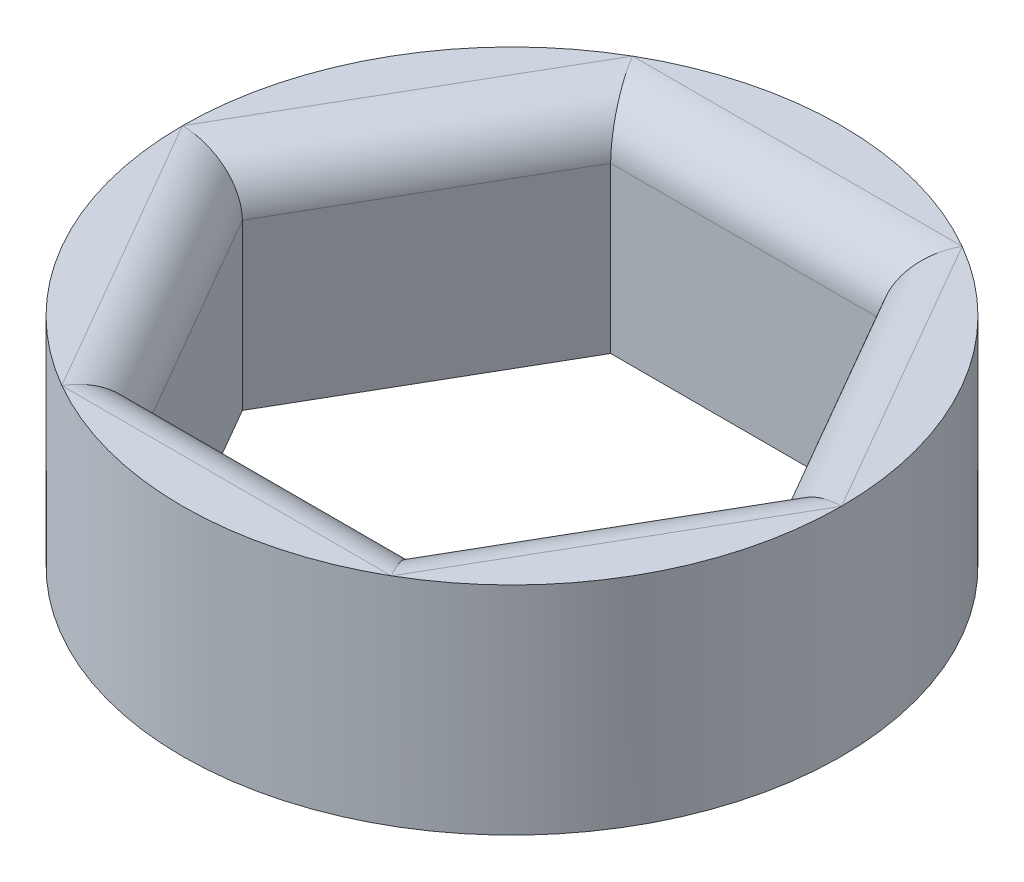
from build123d import *

# Parameters (mm, degrees)
SKETCH1_R           = 6.35
BOSS_EXTRUDE1_DEPTH = 4.175
FILLET1_R           = 1


with BuildPart() as part:
    # Sketch1 → Boss-Extrude1 (new body)
    with BuildSketch(Plane(origin=(0, 0, 0), x_dir=(1, 0, 0), z_dir=(0, 1, 0))):
        with Locations(Location((0, 0, 0), (0, 0, 270))):
            Circle(SKETCH1_R)
        Polygon((5.196152423, 0), (2.598076211, 4.5), (-2.598076211, 4.5), (-5.196152423, 0), (-2.598076211, -4.5), (2.598076211, -4.5), align=None, mode=Mode.SUBTRACT)
    extrude(amount=BOSS_EXTRUDE1_DEPTH)

    # Fillet1
    # the kernel refuses this fillet: 1 mm, written as the material it takes off along each edge
    with BuildSketch(Plane(origin=(1.348076211, 4.175, 6.665063509), x_dir=(0, -1, 0), z_dir=(0.4999999999999997, 0, -0.8660254037844388))) as fillet1_piece_1_section:
        with BuildLine():
            CenterArc((FILLET1_R, -FILLET1_R), FILLET1_R, 90, 90)
            Line((0, -FILLET1_R), (-FILLET1_R * 0.02, -FILLET1_R))
            Line((-FILLET1_R * 0.02, -FILLET1_R), (-FILLET1_R * 0.02, FILLET1_R * 0.02))
            Line((-FILLET1_R * 0.02, FILLET1_R * 0.02), (FILLET1_R, FILLET1_R * 0.02))
            Line((FILLET1_R, FILLET1_R * 0.02), (FILLET1_R, 0))
        make_face()
    fillet1_piece_1 = extrude(amount=10.196152423, mode=Mode.PRIVATE)
    fillet1_piece_1 = split(fillet1_piece_1, bisect_by=Plane(origin=(4.083759971, 3.942180167, 4.5), z_dir=(0, 0, -1)), keep=Keep.TOP, mode=Mode.PRIVATE)
    fillet1_piece_1 = split(fillet1_piece_1, bisect_by=Plane(origin=(5.938994303, 3.942180167, 1.286639878), z_dir=(-0.8660254037844387, 0, 0.49999999999999983)), keep=Keep.TOP, mode=Mode.PRIVATE)
    add(fillet1_piece_1, mode=Mode.SUBTRACT)
    with BuildSketch(Plane(origin=(6.446152423, 4.175, 2.165063509), x_dir=(0, -1, 0), z_dir=(-0.4999999999999999, 0, -0.8660254037844388))) as fillet1_piece_2_section:
        with BuildLine():
            CenterArc((FILLET1_R, -FILLET1_R), FILLET1_R, 90, 90)
            Line((0, -FILLET1_R), (-FILLET1_R * 0.02, -FILLET1_R))
            Line((-FILLET1_R * 0.02, -FILLET1_R), (-FILLET1_R * 0.02, FILLET1_R * 0.02))
            Line((-FILLET1_R * 0.02, FILLET1_R * 0.02), (FILLET1_R, FILLET1_R * 0.02))
            Line((FILLET1_R, FILLET1_R * 0.02), (FILLET1_R, 0))
        make_face()
    fillet1_piece_2 = extrude(amount=10.196152423, mode=Mode.PRIVATE)
    fillet1_piece_2 = split(fillet1_piece_2, bisect_by=Plane(origin=(5.938994303, 3.942180167, -1.286639878), z_dir=(-0.8660254037844388, 0, -0.4999999999999997)), keep=Keep.TOP, mode=Mode.PRIVATE)
    fillet1_piece_2 = split(fillet1_piece_2, bisect_by=Plane(origin=(4.083759971, 3.942180167, -4.5), z_dir=(0, 0, 1)), keep=Keep.TOP, mode=Mode.PRIVATE)
    add(fillet1_piece_2, mode=Mode.SUBTRACT)
    with BuildSketch(Plane(origin=(5.098076211, 4.175, -4.5), x_dir=(0, -1, 0), z_dir=(-1, 0, 0))) as fillet1_piece_3_section:
        with BuildLine():
            CenterArc((FILLET1_R, -FILLET1_R), FILLET1_R, 90, 90)
            Line((0, -FILLET1_R), (-FILLET1_R * 0.02, -FILLET1_R))
            Line((-FILLET1_R * 0.02, -FILLET1_R), (-FILLET1_R * 0.02, FILLET1_R * 0.02))
            Line((-FILLET1_R * 0.02, FILLET1_R * 0.02), (FILLET1_R, FILLET1_R * 0.02))
            Line((FILLET1_R, FILLET1_R * 0.02), (FILLET1_R, 0))
        make_face()
    fillet1_piece_3 = extrude(amount=10.196152423, mode=Mode.PRIVATE)
    fillet1_piece_3 = split(fillet1_piece_3, bisect_by=Plane(origin=(-1.855234331, 3.942180167, -5.786639878), z_dir=(0.8660254037844387, 0, 0.4999999999999999)), keep=Keep.TOP, mode=Mode.PRIVATE)
    fillet1_piece_3 = split(fillet1_piece_3, bisect_by=Plane(origin=(1.855234331, 3.942180167, -5.786639878), z_dir=(-0.8660254037844387, 0, 0.49999999999999983)), keep=Keep.TOP, mode=Mode.PRIVATE)
    add(fillet1_piece_3, mode=Mode.SUBTRACT)
    with BuildSketch(Plane(origin=(-1.348076211, 4.175, -6.665063509), x_dir=(0, -1, 0), z_dir=(-0.4999999999999999, 0, 0.8660254037844387))) as fillet1_piece_4_section:
        with BuildLine():
            CenterArc((FILLET1_R, -FILLET1_R), FILLET1_R, 90, 90)
            Line((0, -FILLET1_R), (-FILLET1_R * 0.02, -FILLET1_R))
            Line((-FILLET1_R * 0.02, -FILLET1_R), (-FILLET1_R * 0.02, FILLET1_R * 0.02))
            Line((-FILLET1_R * 0.02, FILLET1_R * 0.02), (FILLET1_R, FILLET1_R * 0.02))
            Line((FILLET1_R, FILLET1_R * 0.02), (FILLET1_R, 0))
        make_face()
    fillet1_piece_4 = extrude(amount=10.196152423, mode=Mode.PRIVATE)
    fillet1_piece_4 = split(fillet1_piece_4, bisect_by=Plane(origin=(-5.938994303, 3.942180167, -1.286639878), z_dir=(0.8660254037844388, 0, -0.4999999999999998)), keep=Keep.TOP, mode=Mode.PRIVATE)
    fillet1_piece_4 = split(fillet1_piece_4, bisect_by=Plane(origin=(-4.083759971, 3.942180167, -4.5), z_dir=(0, 0, 1)), keep=Keep.TOP, mode=Mode.PRIVATE)
    add(fillet1_piece_4, mode=Mode.SUBTRACT)
    with BuildSketch(Plane(origin=(-6.446152423, 4.175, -2.165063509), x_dir=(0, -1, 0), z_dir=(0.4999999999999998, 0, 0.8660254037844388))) as fillet1_piece_5_section:
        with BuildLine():
            CenterArc((FILLET1_R, -FILLET1_R), FILLET1_R, 90, 90)
            Line((0, -FILLET1_R), (-FILLET1_R * 0.02, -FILLET1_R))
            Line((-FILLET1_R * 0.02, -FILLET1_R), (-FILLET1_R * 0.02, FILLET1_R * 0.02))
            Line((-FILLET1_R * 0.02, FILLET1_R * 0.02), (FILLET1_R, FILLET1_R * 0.02))
            Line((FILLET1_R, FILLET1_R * 0.02), (FILLET1_R, 0))
        make_face()
    fillet1_piece_5 = extrude(amount=10.196152423, mode=Mode.PRIVATE)
    fillet1_piece_5 = split(fillet1_piece_5, bisect_by=Plane(origin=(-4.083759971, 3.942180167, 4.5), z_dir=(0, 0, -1)), keep=Keep.TOP, mode=Mode.PRIVATE)
    fillet1_piece_5 = split(fillet1_piece_5, bisect_by=Plane(origin=(-5.938994303, 3.942180167, 1.286639878), z_dir=(0.8660254037844387, 0, 0.4999999999999999)), keep=Keep.TOP, mode=Mode.PRIVATE)
    add(fillet1_piece_5, mode=Mode.SUBTRACT)
    with BuildSketch(Plane(origin=(-5.098076211, 4.175, 4.5), x_dir=(0, -1, 0), z_dir=(1, 0, 0))) as fillet1_piece_6_section:
        with BuildLine():
            CenterArc((FILLET1_R, -FILLET1_R), FILLET1_R, 90, 90)
            Line((0, -FILLET1_R), (-FILLET1_R * 0.02, -FILLET1_R))
            Line((-FILLET1_R * 0.02, -FILLET1_R), (-FILLET1_R * 0.02, FILLET1_R * 0.02))
            Line((-FILLET1_R * 0.02, FILLET1_R * 0.02), (FILLET1_R, FILLET1_R * 0.02))
            Line((FILLET1_R, FILLET1_R * 0.02), (FILLET1_R, 0))
        make_face()
    fillet1_piece_6 = extrude(amount=10.196152423, mode=Mode.PRIVATE)
    fillet1_piece_6 = split(fillet1_piece_6, bisect_by=Plane(origin=(1.855234331, 3.942180167, 5.786639878), z_dir=(-0.8660254037844388, 0, -0.4999999999999997)), keep=Keep.TOP, mode=Mode.PRIVATE)
    fillet1_piece_6 = split(fillet1_piece_6, bisect_by=Plane(origin=(-1.855234331, 3.942180167, 5.786639878), z_dir=(0.8660254037844388, 0, -0.4999999999999998)), keep=Keep.TOP, mode=Mode.PRIVATE)
    add(fillet1_piece_6, mode=Mode.SUBTRACT)
    with BuildSketch(Plane(origin=(1.348076211, 4.175, 6.665063509), x_dir=(0, -1, 0), z_dir=(0.4999999999999997, 0, -0.8660254037844388))) as fillet1_piece_7a_section:
        with BuildLine():
            CenterArc((FILLET1_R, -FILLET1_R), FILLET1_R, 90, 90)
            Line((0, -FILLET1_R), (-FILLET1_R * 0.02, -FILLET1_R))
            Line((-FILLET1_R * 0.02, -FILLET1_R), (-FILLET1_R * 0.02, FILLET1_R * 0.02))
            Line((-FILLET1_R * 0.02, FILLET1_R * 0.02), (FILLET1_R, FILLET1_R * 0.02))
            Line((FILLET1_R, FILLET1_R * 0.02), (FILLET1_R, 0))
        make_face()
    fillet1_piece_7a = extrude(amount=10.196152423, mode=Mode.PRIVATE)
    fillet1_piece_7a = split(fillet1_piece_7a, bisect_by=Plane(origin=(2.212123178, 3.95463069, 4.5), z_dir=(0, 0, 1)), keep=Keep.TOP, mode=Mode.PRIVATE)
    with BuildSketch(Plane(origin=(-5.098076211, 4.175, 4.5), x_dir=(0, -1, 0), z_dir=(1, 0, 0))) as fillet1_piece_7b_section:
        with BuildLine():
            CenterArc((FILLET1_R, -FILLET1_R), FILLET1_R, 90, 90)
            Line((0, -FILLET1_R), (-FILLET1_R * 0.02, -FILLET1_R))
            Line((-FILLET1_R * 0.02, -FILLET1_R), (-FILLET1_R * 0.02, FILLET1_R * 0.02))
            Line((-FILLET1_R * 0.02, FILLET1_R * 0.02), (FILLET1_R, FILLET1_R * 0.02))
            Line((FILLET1_R, FILLET1_R * 0.02), (FILLET1_R, 0))
        make_face()
    fillet1_piece_7b = extrude(amount=10.196152423, mode=Mode.PRIVATE)
    fillet1_piece_7b = split(fillet1_piece_7b, bisect_by=Plane(origin=(2.791052728, 3.95463069, 4.165754869), z_dir=(0.8660254037844388, 0, 0.4999999999999997)), keep=Keep.TOP, mode=Mode.PRIVATE)
    fillet1_piece_7 = fillet1_piece_7a & fillet1_piece_7b
    add(fillet1_piece_7, mode=Mode.SUBTRACT)
    with BuildSketch(Plane(origin=(1.348076211, 4.175, 6.665063509), x_dir=(0, -1, 0), z_dir=(0.4999999999999997, 0, -0.8660254037844388))) as fillet1_piece_8a_section:
        with BuildLine():
            CenterArc((FILLET1_R, -FILLET1_R), FILLET1_R, 90, 90)
            Line((0, -FILLET1_R), (-FILLET1_R * 0.02, -FILLET1_R))
            Line((-FILLET1_R * 0.02, -FILLET1_R), (-FILLET1_R * 0.02, FILLET1_R * 0.02))
            Line((-FILLET1_R * 0.02, FILLET1_R * 0.02), (FILLET1_R, FILLET1_R * 0.02))
            Line((FILLET1_R, FILLET1_R * 0.02), (FILLET1_R, 0))
        make_face()
    fillet1_piece_8a = extrude(amount=10.196152423, mode=Mode.PRIVATE)
    fillet1_piece_8a = split(fillet1_piece_8a, bisect_by=Plane(origin=(5.003175906, 3.95463069, -0.334245131), z_dir=(0.8660254037844387, 0, -0.49999999999999983)), keep=Keep.TOP, mode=Mode.PRIVATE)
    with BuildSketch(Plane(origin=(6.446152423, 4.175, 2.165063509), x_dir=(0, -1, 0), z_dir=(-0.4999999999999999, 0, -0.8660254037844388))) as fillet1_piece_8b_section:
        with BuildLine():
            CenterArc((FILLET1_R, -FILLET1_R), FILLET1_R, 90, 90)
            Line((0, -FILLET1_R), (-FILLET1_R * 0.02, -FILLET1_R))
            Line((-FILLET1_R * 0.02, -FILLET1_R), (-FILLET1_R * 0.02, FILLET1_R * 0.02))
            Line((-FILLET1_R * 0.02, FILLET1_R * 0.02), (FILLET1_R, FILLET1_R * 0.02))
            Line((FILLET1_R, FILLET1_R * 0.02), (FILLET1_R, 0))
        make_face()
    fillet1_piece_8b = extrude(amount=10.196152423, mode=Mode.PRIVATE)
    fillet1_piece_8b = split(fillet1_piece_8b, bisect_by=Plane(origin=(5.003175906, 3.95463069, 0.334245131), z_dir=(0.8660254037844388, 0, 0.4999999999999997)), keep=Keep.TOP, mode=Mode.PRIVATE)
    fillet1_piece_8 = fillet1_piece_8a & fillet1_piece_8b
    add(fillet1_piece_8, mode=Mode.SUBTRACT)
    with BuildSketch(Plane(origin=(5.098076211, 4.175, -4.5), x_dir=(0, -1, 0), z_dir=(-1, 0, 0))) as fillet1_piece_9a_section:
        with BuildLine():
            CenterArc((FILLET1_R, -FILLET1_R), FILLET1_R, 90, 90)
            Line((0, -FILLET1_R), (-FILLET1_R * 0.02, -FILLET1_R))
            Line((-FILLET1_R * 0.02, -FILLET1_R), (-FILLET1_R * 0.02, FILLET1_R * 0.02))
            Line((-FILLET1_R * 0.02, FILLET1_R * 0.02), (FILLET1_R, FILLET1_R * 0.02))
            Line((FILLET1_R, FILLET1_R * 0.02), (FILLET1_R, 0))
        make_face()
    fillet1_piece_9a = extrude(amount=10.196152423, mode=Mode.PRIVATE)
    fillet1_piece_9a = split(fillet1_piece_9a, bisect_by=Plane(origin=(2.791052728, 3.95463069, -4.165754869), z_dir=(0.8660254037844387, 0, -0.49999999999999983)), keep=Keep.TOP, mode=Mode.PRIVATE)
    with BuildSketch(Plane(origin=(6.446152423, 4.175, 2.165063509), x_dir=(0, -1, 0), z_dir=(-0.4999999999999999, 0, -0.8660254037844388))) as fillet1_piece_9b_section:
        with BuildLine():
            CenterArc((FILLET1_R, -FILLET1_R), FILLET1_R, 90, 90)
            Line((0, -FILLET1_R), (-FILLET1_R * 0.02, -FILLET1_R))
            Line((-FILLET1_R * 0.02, -FILLET1_R), (-FILLET1_R * 0.02, FILLET1_R * 0.02))
            Line((-FILLET1_R * 0.02, FILLET1_R * 0.02), (FILLET1_R, FILLET1_R * 0.02))
            Line((FILLET1_R, FILLET1_R * 0.02), (FILLET1_R, 0))
        make_face()
    fillet1_piece_9b = extrude(amount=10.196152423, mode=Mode.PRIVATE)
    fillet1_piece_9b = split(fillet1_piece_9b, bisect_by=Plane(origin=(2.212123178, 3.95463069, -4.5), z_dir=(0, 0, -1)), keep=Keep.TOP, mode=Mode.PRIVATE)
    fillet1_piece_9 = fillet1_piece_9a & fillet1_piece_9b
    add(fillet1_piece_9, mode=Mode.SUBTRACT)
    with BuildSketch(Plane(origin=(-1.348076211, 4.175, -6.665063509), x_dir=(0, -1, 0), z_dir=(-0.4999999999999999, 0, 0.8660254037844387))) as fillet1_piece_10a_section:
        with BuildLine():
            CenterArc((FILLET1_R, -FILLET1_R), FILLET1_R, 90, 90)
            Line((0, -FILLET1_R), (-FILLET1_R * 0.02, -FILLET1_R))
            Line((-FILLET1_R * 0.02, -FILLET1_R), (-FILLET1_R * 0.02, FILLET1_R * 0.02))
            Line((-FILLET1_R * 0.02, FILLET1_R * 0.02), (FILLET1_R, FILLET1_R * 0.02))
            Line((FILLET1_R, FILLET1_R * 0.02), (FILLET1_R, 0))
        make_face()
    fillet1_piece_10a = extrude(amount=10.196152423, mode=Mode.PRIVATE)
    fillet1_piece_10a = split(fillet1_piece_10a, bisect_by=Plane(origin=(-2.212123178, 3.95463069, -4.5), z_dir=(0, 0, -1)), keep=Keep.TOP, mode=Mode.PRIVATE)
    with BuildSketch(Plane(origin=(5.098076211, 4.175, -4.5), x_dir=(0, -1, 0), z_dir=(-1, 0, 0))) as fillet1_piece_10b_section:
        with BuildLine():
            CenterArc((FILLET1_R, -FILLET1_R), FILLET1_R, 90, 90)
            Line((0, -FILLET1_R), (-FILLET1_R * 0.02, -FILLET1_R))
            Line((-FILLET1_R * 0.02, -FILLET1_R), (-FILLET1_R * 0.02, FILLET1_R * 0.02))
            Line((-FILLET1_R * 0.02, FILLET1_R * 0.02), (FILLET1_R, FILLET1_R * 0.02))
            Line((FILLET1_R, FILLET1_R * 0.02), (FILLET1_R, 0))
        make_face()
    fillet1_piece_10b = extrude(amount=10.196152423, mode=Mode.PRIVATE)
    fillet1_piece_10b = split(fillet1_piece_10b, bisect_by=Plane(origin=(-2.791052728, 3.95463069, -4.165754869), z_dir=(-0.8660254037844387, 0, -0.4999999999999999)), keep=Keep.TOP, mode=Mode.PRIVATE)
    fillet1_piece_10 = fillet1_piece_10a & fillet1_piece_10b
    add(fillet1_piece_10, mode=Mode.SUBTRACT)
    with BuildSketch(Plane(origin=(-6.446152423, 4.175, -2.165063509), x_dir=(0, -1, 0), z_dir=(0.4999999999999998, 0, 0.8660254037844388))) as fillet1_piece_11a_section:
        with BuildLine():
            CenterArc((FILLET1_R, -FILLET1_R), FILLET1_R, 90, 90)
            Line((0, -FILLET1_R), (-FILLET1_R * 0.02, -FILLET1_R))
            Line((-FILLET1_R * 0.02, -FILLET1_R), (-FILLET1_R * 0.02, FILLET1_R * 0.02))
            Line((-FILLET1_R * 0.02, FILLET1_R * 0.02), (FILLET1_R, FILLET1_R * 0.02))
            Line((FILLET1_R, FILLET1_R * 0.02), (FILLET1_R, 0))
        make_face()
    fillet1_piece_11a = extrude(amount=10.196152423, mode=Mode.PRIVATE)
    fillet1_piece_11a = split(fillet1_piece_11a, bisect_by=Plane(origin=(-5.003175906, 3.95463069, -0.334245131), z_dir=(-0.8660254037844387, 0, -0.4999999999999999)), keep=Keep.TOP, mode=Mode.PRIVATE)
    with BuildSketch(Plane(origin=(-1.348076211, 4.175, -6.665063509), x_dir=(0, -1, 0), z_dir=(-0.4999999999999999, 0, 0.8660254037844387))) as fillet1_piece_11b_section:
        with BuildLine():
            CenterArc((FILLET1_R, -FILLET1_R), FILLET1_R, 90, 90)
            Line((0, -FILLET1_R), (-FILLET1_R * 0.02, -FILLET1_R))
            Line((-FILLET1_R * 0.02, -FILLET1_R), (-FILLET1_R * 0.02, FILLET1_R * 0.02))
            Line((-FILLET1_R * 0.02, FILLET1_R * 0.02), (FILLET1_R, FILLET1_R * 0.02))
            Line((FILLET1_R, FILLET1_R * 0.02), (FILLET1_R, 0))
        make_face()
    fillet1_piece_11b = extrude(amount=10.196152423, mode=Mode.PRIVATE)
    fillet1_piece_11b = split(fillet1_piece_11b, bisect_by=Plane(origin=(-5.003175906, 3.95463069, 0.334245131), z_dir=(-0.8660254037844388, 0, 0.4999999999999998)), keep=Keep.TOP, mode=Mode.PRIVATE)
    fillet1_piece_11 = fillet1_piece_11a & fillet1_piece_11b
    add(fillet1_piece_11, mode=Mode.SUBTRACT)
    with BuildSketch(Plane(origin=(-5.098076211, 4.175, 4.5), x_dir=(0, -1, 0), z_dir=(1, 0, 0))) as fillet1_piece_12a_section:
        with BuildLine():
            CenterArc((FILLET1_R, -FILLET1_R), FILLET1_R, 90, 90)
            Line((0, -FILLET1_R), (-FILLET1_R * 0.02, -FILLET1_R))
            Line((-FILLET1_R * 0.02, -FILLET1_R), (-FILLET1_R * 0.02, FILLET1_R * 0.02))
            Line((-FILLET1_R * 0.02, FILLET1_R * 0.02), (FILLET1_R, FILLET1_R * 0.02))
            Line((FILLET1_R, FILLET1_R * 0.02), (FILLET1_R, 0))
        make_face()
    fillet1_piece_12a = extrude(amount=10.196152423, mode=Mode.PRIVATE)
    fillet1_piece_12a = split(fillet1_piece_12a, bisect_by=Plane(origin=(-2.791052728, 3.95463069, 4.165754869), z_dir=(-0.8660254037844388, 0, 0.4999999999999998)), keep=Keep.TOP, mode=Mode.PRIVATE)
    with BuildSketch(Plane(origin=(-6.446152423, 4.175, -2.165063509), x_dir=(0, -1, 0), z_dir=(0.4999999999999998, 0, 0.8660254037844388))) as fillet1_piece_12b_section:
        with BuildLine():
            CenterArc((FILLET1_R, -FILLET1_R), FILLET1_R, 90, 90)
            Line((0, -FILLET1_R), (-FILLET1_R * 0.02, -FILLET1_R))
            Line((-FILLET1_R * 0.02, -FILLET1_R), (-FILLET1_R * 0.02, FILLET1_R * 0.02))
            Line((-FILLET1_R * 0.02, FILLET1_R * 0.02), (FILLET1_R, FILLET1_R * 0.02))
            Line((FILLET1_R, FILLET1_R * 0.02), (FILLET1_R, 0))
        make_face()
    fillet1_piece_12b = extrude(amount=10.196152423, mode=Mode.PRIVATE)
    fillet1_piece_12b = split(fillet1_piece_12b, bisect_by=Plane(origin=(-2.212123178, 3.95463069, 4.5), z_dir=(0, 0, 1)), keep=Keep.TOP, mode=Mode.PRIVATE)
    fillet1_piece_12 = fillet1_piece_12a & fillet1_piece_12b
    add(fillet1_piece_12, mode=Mode.SUBTRACT)


solid = part.part
